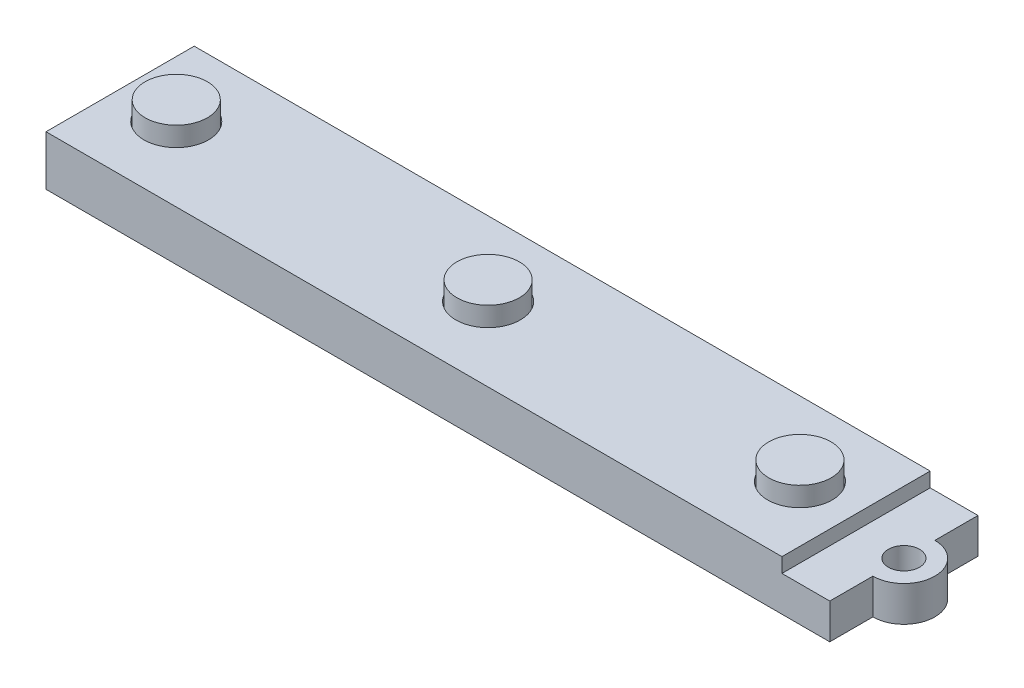
from build123d import *

# Parameters (mm, degrees)
SKETCH1_W           = 99.568
SKETCH1_H           = 18.1102
BOSS_EXTRUDE1_DEPTH = 6.096
SKETCH2_W           = 9.652
SKETCH2_H           = 18.1102
CUT_EXTRUDE1_DEPTH  = 1.778
SKETCH3_R           = 1.905
CUT_EXTRUDE2_DEPTH  = 122.383149472
SKETCH4_R           = 3.937
CUT_EXTRUDE3_DEPTH  = 1.27
SKETCH5_W           = 82.55
SKETCH5_H           = 12.7
BOSS_EXTRUDE2_DEPTH = 1.27
CUT_EXTRUDE4_DEPTH  = 122.434960352
SKETCH8_R           = 3.81
BOSS_EXTRUDE3_DEPTH = 3.556


with BuildPart() as part:
    # Sketch1 → Boss-Extrude1 (new body)
    with BuildSketch(Plane(origin=(0, 0, 0), x_dir=(1, 0, 0), z_dir=(0, 1, 0))):
        with Locations((-66.378666667, 25.894273737)):
            Rectangle(SKETCH1_W, SKETCH1_H)
    extrude(amount=BOSS_EXTRUDE1_DEPTH)

    # Sketch2 → Cut-Extrude1 (cut)
    with BuildSketch(Plane(origin=(0, 6.096, 0), x_dir=(1, 0, 0), z_dir=(0, 1, 0))):
        with Locations((-21.420666667, 25.894273737)):
            Rectangle(SKETCH2_W, SKETCH2_H)
    extrude(amount=-CUT_EXTRUDE1_DEPTH, mode=Mode.SUBTRACT)

    # Sketch3 → Cut-Extrude2 (cut, through all)
    with BuildSketch(Plane(origin=(0, 4.318, 0), x_dir=(1, 0, 0), z_dir=(0, 1, 0))):
        with Locations((-20.404666667, 25.894273737)):
            Circle(SKETCH3_R)
    extrude(amount=-CUT_EXTRUDE2_DEPTH, mode=Mode.SUBTRACT)

    # Sketch4 → Cut-Extrude3 (cut)
    with BuildSketch(Plane(origin=(0, 6.096, 0), x_dir=(1, 0, 0), z_dir=(0, 1, 0))):
        with Locations((-33.104666667, 25.894273737)):
            Circle(SKETCH4_R)
        with Locations((-71.204666667, 25.894273737)):
            Circle(SKETCH4_R)
        with Locations((-109.304666667, 25.894273737)):
            Circle(SKETCH4_R)
    extrude(amount=-CUT_EXTRUDE3_DEPTH, mode=Mode.SUBTRACT)

    # Sketch5 → Boss-Extrude2 (add)
    with BuildSketch(Plane.XZ):
        with Locations((-71.204666667, -25.894273737)):
            Rectangle(SKETCH5_W, SKETCH5_H)
    extrude(amount=BOSS_EXTRUDE2_DEPTH)

    # Sketch7 → Cut-Extrude4 (cut, through all)
    with BuildSketch(Plane(origin=(0, 4.318, 0), x_dir=(1, 0, 0), z_dir=(0, 1, 0))):
        with BuildLine():
            Line((-16.594666667, 34.949373737), (-20.404666667, 34.949373737))
            Line((-20.404666667, 34.949373737), (-20.404666667, 29.680045052))
            ThreePointArc((-20.404666667, 29.680045052), (-16.618895352, 25.894273737), (-20.404666667, 22.108502422))
            Line((-20.404666667, 22.108502422), (-20.404666667, 16.839173737))
            Line((-20.404666667, 16.839173737), (-16.594666667, 16.839173737))
            Line((-16.594666667, 16.839173737), (-16.594666667, 34.949373737))
        make_face()
    extrude(amount=-CUT_EXTRUDE4_DEPTH, mode=Mode.SUBTRACT)

    # Sketch8 → Boss-Extrude3 (add)
    with BuildSketch(Plane(origin=(0, 4.826, 0), x_dir=(1, 0, 0), z_dir=(0, 1, 0))):
        with Locations((-33.104666667, 25.894273737)):
            Circle(SKETCH8_R)
        with Locations((-71.204666667, 25.894273737)):
            Circle(SKETCH8_R)
        with Locations((-109.304666667, 25.894273737)):
            Circle(SKETCH8_R)
    extrude(amount=BOSS_EXTRUDE3_DEPTH)


solid = part.part
